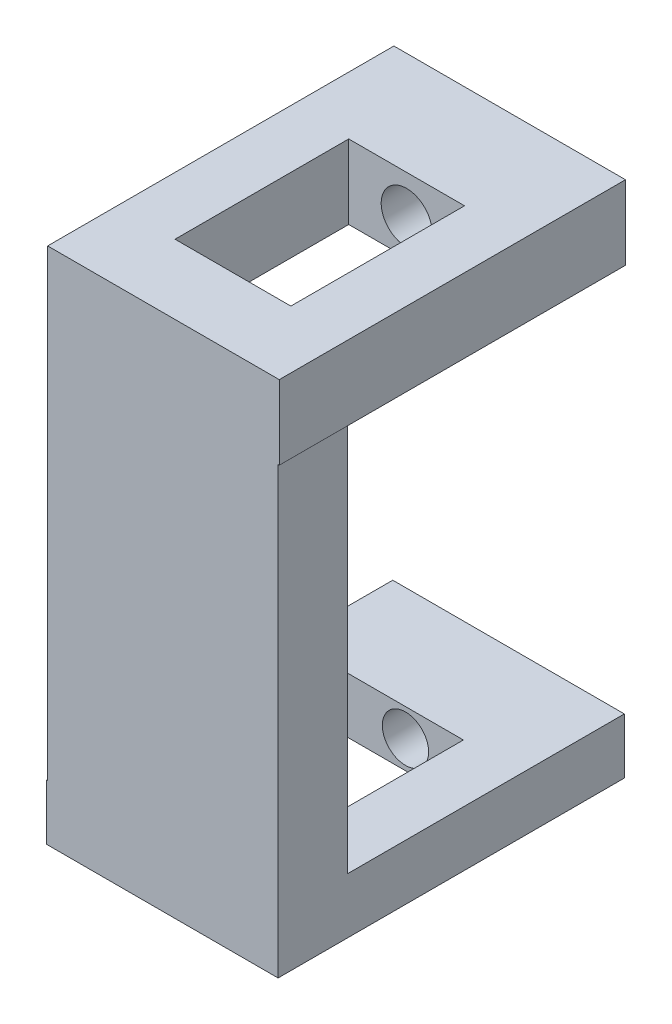
from build123d import *

# Parameters (mm, degrees)
SZKIC2_W                      = 10
SZKIC2_H                      = 3.2
SZKIC2_R                      = 1.10000034
DODANIE_WYCI_GNI_CIE1_DEPTH   = 14.95
SZKIC2_H_2                    = 2.4000007
SZKIC2_R_2                    = 1.00000054
DODANIE_WYCI_GNI_CIE1_2_DEPTH = 14.95
SZKIC3_W                      = 5
SZKIC3_H                      = 3.2
SZKIC3_H_2                    = 2.4000007
WYTNIJ_WYCI_GNI_CIE1_DEPTH    = 10.5
SZKIC4_W                      = 9.95021092
SZKIC4_H                      = 22.39976104
DODANIE_WYCI_GNI_CIE2_DEPTH   = 3


with BuildPart() as part:
    # Szkic2 → Dodanie-wyciągnięcie1 (new body)
    with BuildSketch(Plane.XY.offset(158.832884642)):
        with Locations((-14.923531216, -1.67449554)):
            Rectangle(SZKIC2_W, SZKIC2_H)
        with Locations((-14.923531216, -1.77449554)):
            Circle(SZKIC2_R, mode=Mode.SUBTRACT)
    extrude(amount=DODANIE_WYCI_GNI_CIE1_DEPTH)


with BuildPart() as body_2:
    # Szkic2 → Dodanie-wyci_gni_cie1 2 (new body)
    with BuildSketch(Plane.XY.offset(158.832884642)):
        with Locations((-14.973320296, -21.27425623)):
            Rectangle(SZKIC2_W, SZKIC2_H_2)
        with Locations((-14.973320296, -21.27425588)):
            Circle(SZKIC2_R_2, mode=Mode.SUBTRACT)
    extrude(amount=DODANIE_WYCI_GNI_CIE1_2_DEPTH)


with BuildPart() as wytnij_wyci_gni_cie1_tool:
    # Szkic3 → Wytnij-wyciągnięcie1 (new body)
    with BuildSketch(Plane.XY.offset(173.782884642)):
        with Locations((-14.923531216, -1.67449554)):
            Rectangle(SZKIC3_W, SZKIC3_H)
        with Locations((-14.973320296, -21.27425623)):
            Rectangle(SZKIC3_W, SZKIC3_H_2)
    extrude(amount=-WYTNIJ_WYCI_GNI_CIE1_DEPTH)


with BuildPart() as part_1:
    add(part.part)

    # Wytnij-wyciągnięcie1: cut by wytnij_wyci_gni_cie1_tool
    add(wytnij_wyci_gni_cie1_tool.part, mode=Mode.SUBTRACT)



with BuildPart() as body_2_1:
    add(body_2.part)

    # Wytnij-wyciągnięcie1: cut by wytnij_wyci_gni_cie1_tool
    add(wytnij_wyci_gni_cie1_tool.part, mode=Mode.SUBTRACT)


with BuildPart() as part_2:
    add(part_1.part)

    add(body_2_1.part)  # Dodanie-wyciągnięcie2 merges body 2
    # Szkic4 → Dodanie-wyciągnięcie2 (add)
    with BuildSketch(Plane.XY.offset(173.782884642)):
        with Locations((-14.948425756, -11.27437606)):
            Rectangle(SZKIC4_W, SZKIC4_H)
    extrude(amount=-DODANIE_WYCI_GNI_CIE2_DEPTH)


solid = part_2.part
